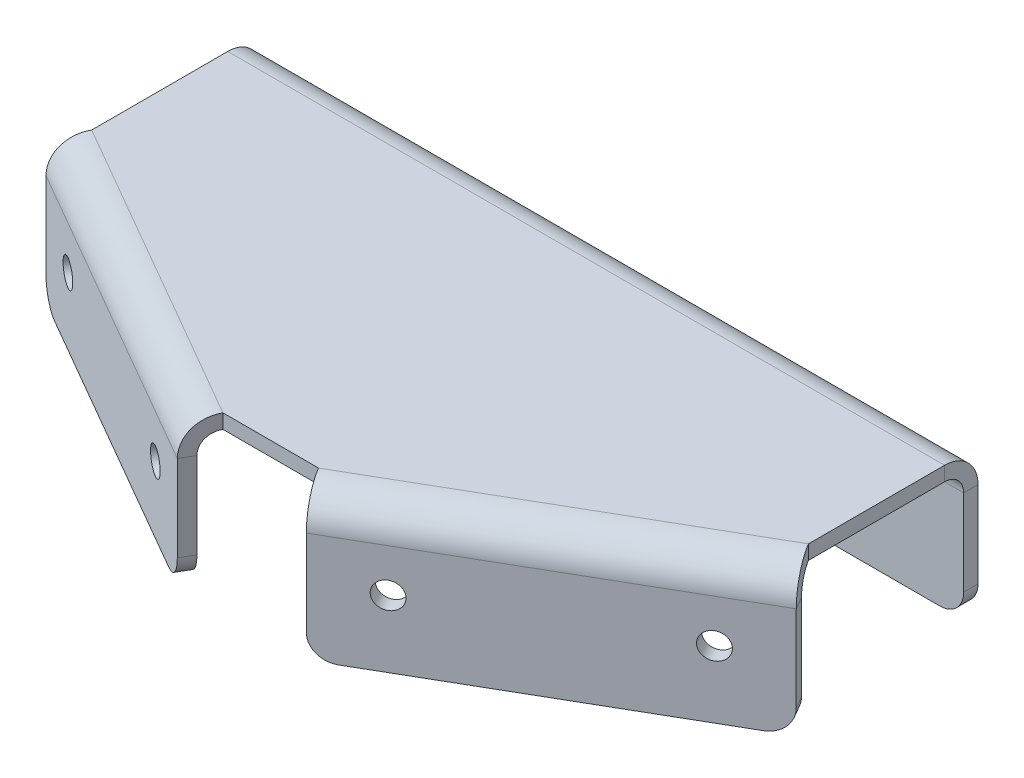
from build123d import *

# Parameters (mm, degrees)
ODGI_CIE_BAZOWE1_DEPTH        = 75
WYTNIJ_WYCI_GNI_CIE1_DEPTH    = 10
ODGI_CIE_KRAW_DZI1_DEPTH      = 75.055534995
ODGI_CIE_KRAW_DZI1_BEND_DEPTH = 75.055534995
OTW_R_POD_RUB_M52_D           = 5.5
OTW_R_POD_RUB_M52_DEPTH       = 10
OTW_R_POD_RUB_M52_TIP         = 1.652366702
OTW_R_POD_RUB_M51_AT_2_COUNT  = 2
OTW_R_POD_RUB_M51_AT_2_PITCH  = 50
ZAOKR_GLENIE1_R               = 5


# Sheet-metal steps are written as plain solids
with BuildPart() as part:
    # Szkic1 → Odgięcie bazowe1 (new, symmetric)
    with BuildSketch(Plane(origin=(0, 0, 0), x_dir=(0, 0, -1), z_dir=(1, 0, 0))):
        with BuildLine():
            Line((0, -27), (0, -4))
            ThreePointArc((0, -4), (-1.171572875, -1.171572875), (-4, 0))
            Line((-4, 0), (-70, 0))
            Line((-70, 0), (-70, 3))
            Line((-70, 3), (-4, 3))
            ThreePointArc((-4, 3), (0.949747468, 0.949747468), (3, -4))
            Line((3, -4), (3, -27))
            Line((3, -27), (0, -27))
        make_face()
    extrude(amount=ODGI_CIE_BAZOWE1_DEPTH, both=True)

    # Szkic6 → Wytnij-wyciągnięcie1 (cut)
    with BuildSketch(Plane(origin=(0, 3, 0), x_dir=(1, 0, 0), z_dir=(0, 1, 0))):
        Polygon((-75, -32.472232503), (-10, -70), (-75, -70), align=None)
        Polygon((75, -70), (75, -32.472232503), (10, -70), align=None)
    extrude(amount=-WYTNIJ_WYCI_GNI_CIE1_DEPTH, mode=Mode.SUBTRACT)

    # Odgięcie krawędzi1 section (across the edge) → Odgięcie krawędzi1 (add)
    with BuildSketch(Plane(origin=(-12, 0, 73.464101615), x_dir=(0.4999999999999948, -3.3854238149706416e-15, -0.8660254037844417), z_dir=(-0.8660254037844417, 0, -0.4999999999999948))):
        with BuildLine():
            Line((-3, 4), (-3, 27))
            Line((-3, 27), (0, 27))
            Line((0, 27), (0, 4))
            ThreePointArc((0, 4), (1.171572875, 1.171572875), (4, 0))
            Line((4, 0), (4, -3))
            ThreePointArc((4, -3), (-0.949747468, -0.949747468), (-3, 4))
        make_face()
    extrude(amount=ODGI_CIE_KRAW_DZI1_DEPTH)

    # Odgięcie krawędzi1 section 2 (across the edge) → Odgięcie krawędzi1 bend (add)
    with BuildSketch(Plane(origin=(77, 0, 35.936334118), x_dir=(-0.49999999999999467, -3.3854238149706423e-15, -0.8660254037844417), z_dir=(-0.8660254037844417, 0, 0.49999999999999467))):
        with BuildLine():
            Line((-3, 4), (-3, 27))
            Line((-3, 27), (0, 27))
            Line((0, 27), (0, 4))
            ThreePointArc((0, 4), (1.171572875, 1.171572875), (4, 0))
            Line((4, 0), (4, -3))
            ThreePointArc((4, -3), (-0.949747468, -0.949747468), (-3, 4))
        make_face()
    extrude(amount=ODGI_CIE_KRAW_DZI1_BEND_DEPTH)

    # Otwór pod śrubę M52
    with Locations(Plane(origin=(0, 0, -3), x_dir=(-1, 0, 0), z_dir=(0, 0, -1))):
        with Locations((-30, -15), (30, -15)):
            Hole(OTW_R_POD_RUB_M52_D / 2, depth=OTW_R_POD_RUB_M52_DEPTH)
            with Locations((0, 0, -(OTW_R_POD_RUB_M52_DEPTH + OTW_R_POD_RUB_M52_TIP / 2))):  # 118° drill point
                Cone(0, OTW_R_POD_RUB_M52_D / 2, OTW_R_POD_RUB_M52_TIP, mode=Mode.SUBTRACT)

    # Szkic16 → Otwór pod śrubę M51 (revolve, cut)
    with BuildSketch(Plane(origin=(-67.650635095, -13, 44.798294078), x_dir=(0.8660254037844417, 0, 0.4999999999999949), z_dir=(0, 1, 0))):
        Polygon((0, 0), (0, 11.652366702), (2.75, 10), (2.75, 0), align=None)
    otw_r_pod_rub_m51 = revolve(axis=Axis((-70.825635095, -13, 50.297555392), (0.4999999999999949, -3.3879771740092313e-15, -0.8660254037844417)), mode=Mode.SUBTRACT)

    # Otwór pod śrubę M51 at 2: Otwór pod śrubę M51 ×2
    with Locations(*[Vector(0.8660254037844417, 1.9224128461953825e-15, 0.49999999999999495) * (i * OTW_R_POD_RUB_M51_AT_2_PITCH) for i in range(1, OTW_R_POD_RUB_M51_AT_2_COUNT)]):
        add(otw_r_pod_rub_m51, mode=Mode.SUBTRACT)

    # Lustro1: Otwór pod śrubę M51 across plane
    add(otw_r_pod_rub_m51.mirror(Plane(origin=(0, 0, 0), x_dir=(0, 0, 1), z_dir=(1, 0, 0))), mode=Mode.SUBTRACT)

    # Lustro1 copy 1 sketch → Lustro1 copy 1 (revolve, cut)
    with BuildSketch(Plane(origin=(24.349364905, -13, 69.798294078), x_dir=(-0.8660254037844417, 0, 0.4999999999999949), z_dir=(0, 1, 0))):
        Polygon((0, 0), (0, -11.652366702), (2.75, -10), (2.75, 0), align=None)
    revolve(axis=Axis((27.524364905, -13, 75.297555392), (0.4999999999999949, 3.3879771740092313e-15, 0.8660254037844417)), mode=Mode.SUBTRACT)

    # Zaokrąglenie1
    zaokr_glenie1_edges = [part.edges().sort_by_distance(p)[0] for p in [
        (75, -27, -1.5),
        (-12.75, -27, 74.763139721),
        (-77.75, -27, 37.235372223),
        (-75, -27, -1.5),
        (77.75, -27, 37.235372223),
        (12.75, -27, 74.763139721),
    ]]
    fillet(zaokr_glenie1_edges, radius=ZAOKR_GLENIE1_R)


solid = part.part
